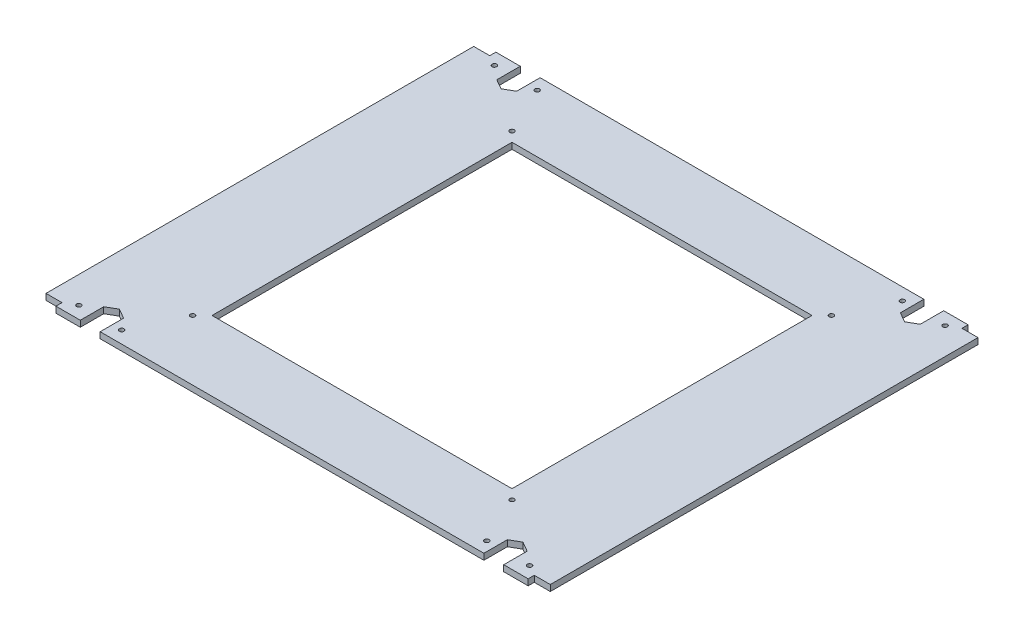
from build123d import *

# Parameters (mm, degrees)
SKETCH1_R           = 1.5
SKETCH1_W           = 196.314766664
SKETCH1_H           = 196.314766664
BOSS_EXTRUDE1_DEPTH = 4


with BuildPart() as part:
    # Sketch1 → Boss-Extrude1 (new body)
    with BuildSketch(Plane(origin=(0, 0, 0), x_dir=(1, 0, 0), z_dir=(0, 1, 0))):
        Polygon((154.53, -139.95), (165, -139.95), (165, 139.95), (154.53, 139.95), (154.53, 143.95), (138.55, 143.95), (138.55, 128.61722325), (132.05, 124.864446501), (125.55, 128.61722325), (125.55, 143.95), (-125.55, 143.95), (-125.55, 128.61722325), (-132.05, 124.864446501), (-138.55, 128.61722325), (-138.55, 143.95), (-154.53, 143.95), (-154.53, 139.95), (-165, 139.95), (-165, -139.95), (-154.53, -139.95), (-154.53, -143.95), (-138.55, -143.95), (-138.55, -128.61722325), (-132.05, -124.864446501), (-125.55, -128.61722325), (-125.55, -143.95), (125.55, -143.95), (125.55, -128.61722325), (132.05, -124.864446501), (138.55, -128.61722325), (138.55, -143.95), (154.53, -143.95), align=None)
        with Locations((-147.47, -135.95)):
            Circle(SKETCH1_R, mode=Mode.SUBTRACT)
        with Locations((-119.47, -135.95)):
            Circle(SKETCH1_R, mode=Mode.SUBTRACT)
        with Locations((-104.5, -104.5)):
            Circle(SKETCH1_R, mode=Mode.SUBTRACT)
        with Locations((119.47, -135.95)):
            Circle(SKETCH1_R, mode=Mode.SUBTRACT)
        with Locations((147.47, -135.95)):
            Circle(SKETCH1_R, mode=Mode.SUBTRACT)
        with Locations((104.5, -104.5)):
            Circle(SKETCH1_R, mode=Mode.SUBTRACT)
        with Locations((-104.5, 104.5)):
            Circle(SKETCH1_R, mode=Mode.SUBTRACT)
        with Locations((-147.47, 135.95)):
            Circle(SKETCH1_R, mode=Mode.SUBTRACT)
        with Locations((-119.47, 135.95)):
            Circle(SKETCH1_R, mode=Mode.SUBTRACT)
        Rectangle(SKETCH1_W, SKETCH1_H, mode=Mode.SUBTRACT)
        with Locations((104.5, 104.5)):
            Circle(SKETCH1_R, mode=Mode.SUBTRACT)
        with Locations((119.47, 135.95)):
            Circle(SKETCH1_R, mode=Mode.SUBTRACT)
        with Locations((147.47, 135.95)):
            Circle(SKETCH1_R, mode=Mode.SUBTRACT)
    extrude(amount=BOSS_EXTRUDE1_DEPTH)


solid = part.part
